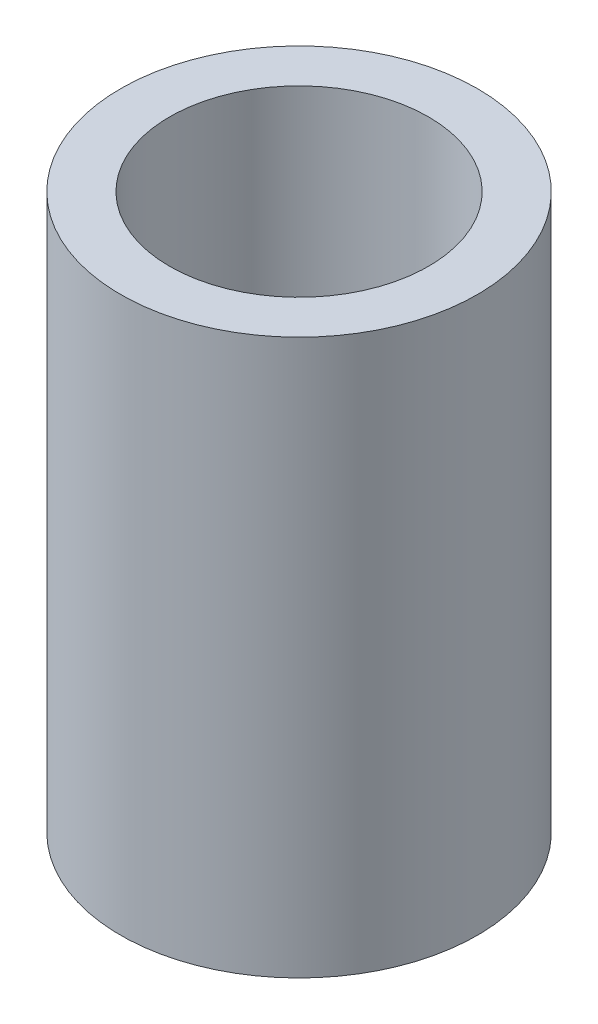
from build123d import *

# Parameters (mm, degrees)
SKETCH1_R           = 6.75
BOSS_EXTRUDE1_DEPTH = 21
SKETCH2_R           = 4.9
CUT_EXTRUDE1_DEPTH  = 10
CUT_EXTRUDE2_DEPTH  = 8


with BuildPart() as part:
    # Sketch1 → Boss-Extrude1 (new body)
    with BuildSketch(Plane(origin=(0, 0, 0), x_dir=(1, 0, 0), z_dir=(0, 1, 0))):
        Circle(SKETCH1_R)
    extrude(amount=BOSS_EXTRUDE1_DEPTH)

    # Sketch2 → Cut-Extrude1 (cut)
    with BuildSketch(Plane(origin=(0, 21, 0), x_dir=(1, 0, 0), z_dir=(0, 1, 0))):
        Circle(SKETCH2_R)
    extrude(amount=-CUT_EXTRUDE1_DEPTH, mode=Mode.SUBTRACT)

    # Sketch3 → Cut-Extrude2 (cut)
    with BuildSketch(Plane.XZ):
        with BuildLine():
            Line((-0.882021488, -1.21327577), (1.357978512, -0.637098392))
            ThreePointArc((1.357978512, -0.637098392), (-0.373669459, 1.452711649), (-0.882021488, -1.21327577))
        make_face()
    extrude(amount=-CUT_EXTRUDE2_DEPTH, mode=Mode.SUBTRACT)


solid = part.part
